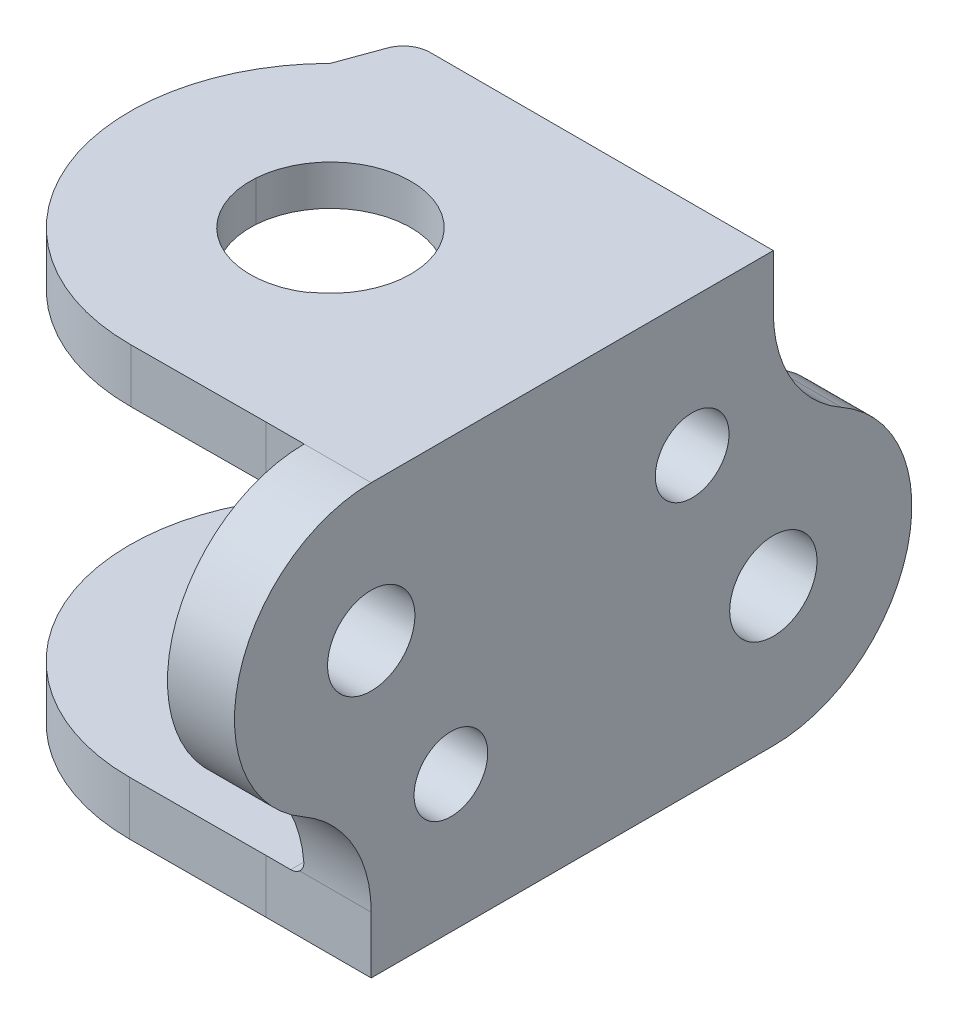
from build123d import *
from build123d.topology import SkipClean

# Parameters (mm, degrees)
BOSS_EXTRUDE1_DEPTH     = 4
SKETCH3_W               = 5
SKETCH3_H               = 30
BOSS_EXTRUDE3_DEPTH     = 24
BOSS_EXTRUDE5_DEPTH     = 5
SKETCH7_3_R             = 3.25755
CUT_EXTRUDE3_DEPTH      = 5
FILLET3_R               = 10
BOSS_EXTRUDE8_START     = -4
BOSS_EXTRUDE8_DEPTH     = 4
BOSS_EXTRUDE9_DEPTH     = 4
CUT_EXTRUDE4_DEPTH      = 25
CUT_EXTRUDE4_DEPTH_BACK = 1
SKETCH8_R               = 7.5
CUT_EXTRUDE5_DEPTH      = 50.517048882
CUT_EXTRUDE5_DEPTH_BACK = 50.517048882
SKETCH9_R               = 2.75
FILLET4_R               = 1
BOSS_EXTRUDE6_START     = -4
BOSS_EXTRUDE6_DEPTH     = 4
FILLET6_R               = 2
BOSS_EXTRUDE7_DEPTH     = 4


# Read off the part's stored shape, not the designer's step: Boss-Extrude8
with BuildPart() as part:
    # Sketch2 → Boss-Extrude1 (new body)
    with BuildSketch(Plane(origin=(0, 0, 0), x_dir=(1, 0, 0), z_dir=(0, 1, 0))):
        with BuildLine():
            Line((18.000912404, -14.946929254), (18.000912404, 15.053070746))
            Line((18.000912404, 15.053070746), (0.039090451, 15.053070746))
            ThreePointArc((0.039090451, 15.053070746), (-10.199781301, 11.024824414), (-14.94907539, 1.099832277))
            Line((-14.94907539, 1.099832277), (-5.983249792, 0.448020006))
            ThreePointArc((-5.983249792, 0.448020006), (3.000957071, 5.20912276), (3.369824569, -4.951979994))
            Line((3.369824569, -4.951979994), (10.151696986, -14.946929254))
            Line((10.151696986, -14.946929254), (18.000912404, -14.946929254))
        make_face()
    boss_extrude1 = extrude(amount=BOSS_EXTRUDE1_DEPTH)

    # Sketch3 → Boss-Extrude3 (add)
    with BuildSketch(Plane(origin=(0, 4, 0), x_dir=(1, 0, 0), z_dir=(0, 1, 0))):
        with Locations((15.500912404, 0.053070746)):
            Rectangle(SKETCH3_W, SKETCH3_H)
    extrude(amount=BOSS_EXTRUDE3_DEPTH)

    # Mirror1: Boss-Extrude1 across plane
    add(boss_extrude1.mirror(Plane.ZX.offset(16)))

    # Sketch7 → Boss-Extrude5 (add)
    with BuildSketch(Plane.ZY.offset(-13.000912404)):
        with BuildLine():
            Line((-15.053070746, 0), (-15.053070746, 4))
            Line((-15.053070746, 4), (-15.053070746, 7.075913265))
            ThreePointArc((-15.053070746, 7.075913265), (-18.310620746, 10.333463265), (-15.053070746, 13.591013265))
            Line((-15.053070746, 13.591013265), (-15.053070746, 20.666926531))
            ThreePointArc((-15.053070746, 20.666926531), (-25.386534011, 10.333463265), (-15.053070746, 0))
        make_face()
        with BuildLine():
            ThreePointArc((25.146929254, 21.8), (22.159418422, 29.012489168), (14.946929254, 32))
            Line((14.946929254, 32), (14.946929254, 28))
            Line((14.946929254, 28), (14.946929254, 25.05755))
            ThreePointArc((14.946929254, 25.05755), (17.250364949, 24.103435695), (18.204479254, 21.8))
            ThreePointArc((18.204479254, 21.8), (17.250364949, 19.496564305), (14.946929254, 18.54245))
            Line((14.946929254, 18.54245), (14.946929254, 11.6))
            ThreePointArc((14.946929254, 11.6), (22.159418422, 14.587510832), (25.146929254, 21.8))
        make_face()
        with BuildLine():
            Line((14.946929254, 28), (14.946929254, 32))
            ThreePointArc((14.946929254, 32), (4.746929254, 21.8), (14.946929254, 11.6))
            Line((14.946929254, 11.6), (14.946929254, 18.54245))
            ThreePointArc((14.946929254, 18.54245), (11.689379254, 21.8), (14.946929254, 25.05755))
            Line((14.946929254, 25.05755), (14.946929254, 28))
        make_face()
    extrude(amount=-BOSS_EXTRUDE5_DEPTH)

    # Sketch7<3> → Cut-Extrude3 (cut)
    with SkipClean():  # the faces are left unmerged after this step: merging them gives an invalid solid
        with BuildSketch(Plane.ZY.offset(-13.000912404)):
            with Locations((14.946929254, 21.8)):
                Circle(SKETCH7_3_R)
            with Locations((-15.053070746, 10.333463265)):
                Circle(SKETCH7_3_R)
        extrude(amount=-CUT_EXTRUDE3_DEPTH, mode=Mode.SUBTRACT)

    # Fillet3
    # the kernel refuses this fillet: 10 mm, written as the material it adds along each edge
    with BuildSketch(Plane(origin=(13.000912404, 20.666926531, -15.053070746), x_dir=(0, -0.25425566101904284, -0.9671370424297528), z_dir=(1, 0, 0))) as fillet3_piece_1:
        with BuildLine():
            CenterArc((7.797239676, 9.671370424), FILLET3_R, 194.729484057, 60.541031886)
            Line((-1.874130748, 7.128813814), (0, 0))
            ThreePointArc((0, 0), (2.627341533, 0.339588165), (5.254683066, 0))
        make_face()
    extrude(amount=5)
    with BuildSketch(Plane(origin=(13.000912404, 11.6, 14.946929254), x_dir=(0, -1, 0), z_dir=(1, 0, 0))) as fillet3_piece_2:
        with BuildLine():
            CenterArc((7.351068344, -10), FILLET3_R, 90, 60.326985198)
            ThreePointArc((-1.337579351, -5.04950495), (-0.340063626, -2.611829759), (0, 0))
            Line((0, 0), (7.351068344, 0))
        make_face()
    extrude(amount=5)

    # Boss-Extrude8 outline → Boss-Extrude8 (add)
    with SkipClean():  # the faces are left unmerged after this step: merging them gives an invalid solid
        with BuildSketch(Plane.XZ.offset(BOSS_EXTRUDE8_START)):
            with BuildLine():
                ThreePointArc((-5.983249792, -0.448020006), (-3.002134964, 5.194919216), (3.375546051, 4.960412166))
                Line((3.375546051, 4.960412166), (10.151696986, 14.946929254))
                Line((10.151696986, 14.946929254), (0, 14.989479178))
                ThreePointArc((0, 14.989479178), (-10.981129247, 10.202905787), (-14.94907539, -1.099832277))
                Line((-14.94907539, -1.099832277), (-5.983249792, -0.448020006))
            make_face()
        extrude(amount=BOSS_EXTRUDE8_DEPTH)

    # Sketch13 → Boss-Extrude9 (add)
    with SkipClean():  # the faces are left unmerged after this step: merging them gives an invalid solid
        with BuildSketch(Plane(origin=(0, 32, 0), x_dir=(1, 0, 0), z_dir=(0, 1, 0))):
            with BuildLine():
                Line((10.151696986, -14.946929254), (8.443727077, -12.429767101))
                ThreePointArc((8.443727077, -12.429767101), (4.471376939, -14.331468239), (0.118292185, -14.999813933))
                Line((0.118292185, -14.999813933), (10.151696986, -14.946929254))
            make_face()
            with BuildLine():
                ThreePointArc((6.07616266, 0.026524042), (5.364215569, -2.817642503), (3.396292996, -4.990988482))
                Line((3.396292996, -4.990988482), (8.443727077, -12.429767101))
                ThreePointArc((8.443727077, -12.429767101), (13.307281184, -7.027001355), (15.065637155, 0.026524042))
                ThreePointArc((15.065637155, 0.026524042), (10.664463523, 10.651897114), (0.039090451, 15.053070746))
                ThreePointArc((0.039090451, 15.053070746), (-10.199781301, 11.024824414), (-14.94907539, 1.099832277))
                Line((-14.94907539, 1.099832277), (-5.983249792, 0.448020006))
                ThreePointArc((-5.983249792, 0.448020006), (0.249967121, 6.059912135), (6.07616266, 0.026524042))
            make_face()
            with BuildLine():
                Line((8.443727077, -12.429767101), (3.396292996, -4.990988482))
                ThreePointArc((3.396292996, -4.990988482), (-2.989348597, -5.196003869), (-5.983249792, 0.448020006))
                Line((-5.983249792, 0.448020006), (-14.94907539, 1.099832277))
                ThreePointArc((-14.94907539, 1.099832277), (-10.932188175, -10.241297106), (0.118292185, -14.999813933))
                ThreePointArc((0.118292185, -14.999813933), (4.471376939, -14.331468239), (8.443727077, -12.429767101))
            make_face()
        extrude(amount=-BOSS_EXTRUDE9_DEPTH)

    # Sketch8 → Cut-Extrude4 (cut, two sides: drawn at the far end of the back side and taken through both)
    with SkipClean():  # the faces are left unmerged after this step: merging them gives an invalid solid
        with BuildSketch(Plane(origin=(0, 4, 0), x_dir=(1, 0, 0), z_dir=(0, 1, 0)).offset(-CUT_EXTRUDE4_DEPTH_BACK)):
            with Locations(Location((0, 0, 0), (0, 0, 90))):
                Circle(SKETCH8_R)
        extrude(amount=CUT_EXTRUDE4_DEPTH + CUT_EXTRUDE4_DEPTH_BACK, mode=Mode.SUBTRACT)

    # Sketch9 → Cut-Extrude5 (cut, two sides: drawn at the far end of the back side and taken through both)
    with BuildSketch(Plane.ZY.offset(-13.000912404).offset(-CUT_EXTRUDE5_DEPTH_BACK)):
        with Locations((9, 10.2)):
            Circle(SKETCH9_R)
        with Locations((-9, 21.8)):
            Circle(SKETCH9_R)
    extrude(amount=CUT_EXTRUDE5_DEPTH + CUT_EXTRUDE5_DEPTH_BACK, mode=Mode.SUBTRACT)

    # Fillet4
    fillet4_edges = [part.edges().sort_by_distance(p)[0] for p in [
        (13.000912404, 4, -0.053070746),
        (13.000912404, 28, -0.053070746),
    ]]
    fillet(fillet4_edges, radius=FILLET4_R)

    # Sketch10 → Boss-Extrude6 (add)
    with BuildSketch(Plane.XZ.offset(BOSS_EXTRUDE6_START)):
        with BuildLine():
            ThreePointArc((0.039090451, -15.053070746), (-5.733491903, -13.900038334), (-10.620178824, -10.617892431))
            Line((-10.620178824, -10.617892431), (-9.005905934, -15.053070746))
            Line((-9.005905934, -15.053070746), (0.039090451, -15.053070746))
        make_face()
    extrude(amount=BOSS_EXTRUDE6_DEPTH)

    # Fillet6
    fillet6_edges = [part.edges().sort_by_distance(p)[0] for p in [
        (-9.005905934, 2, -15.053070746),
    ]]
    fillet(fillet6_edges, radius=FILLET6_R)

    # Sketch11 → Boss-Extrude7 (add)
    with BuildSketch(Plane(origin=(0, 32, 0), x_dir=(1, 0, 0), z_dir=(0, 1, 0))):
        with BuildLine():
            Line((-9.484876099, 13.737111032), (-10.620178824, 10.617892431))
            ThreePointArc((-10.620178824, 10.617892431), (-5.733491903, 13.900038334), (0.039090451, 15.053070746))
            Line((0.039090451, 15.053070746), (-7.605490857, 15.053070746))
            ThreePointArc((-7.605490857, 15.053070746), (-8.75264373, 14.691374834), (-9.484876099, 13.737111032))
        make_face()
    extrude(amount=-BOSS_EXTRUDE7_DEPTH)


solid = part.part
